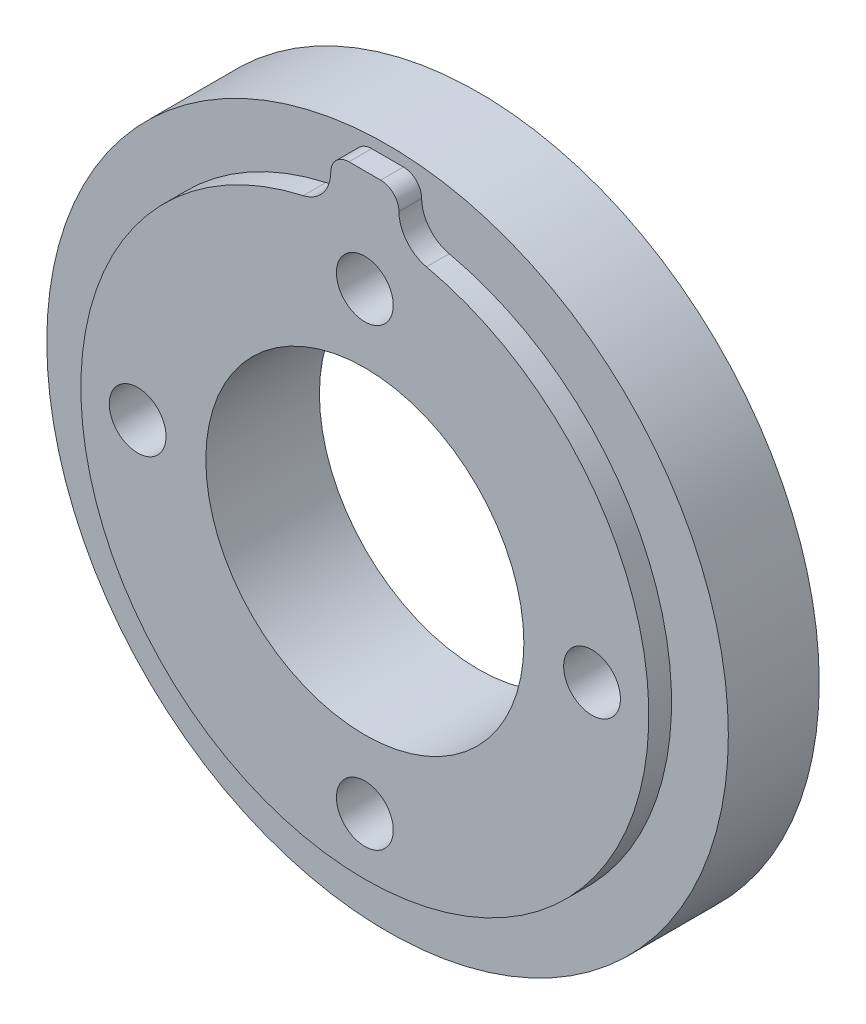
from build123d import *

# Parameters (mm, degrees)
SKETCH_1_R          = 15
EXTRUDE_1_DEPTH     = 4
EXTRUDE_2_DEPTH     = 1
FILLET_1_R          = 1.55
FILLET_2_R          = 0.8
SKETCH_3_R          = 7
CUT_EXTRUDE_1_DEPTH = 22.794494855
SKETCH_4_R          = 1.25
CUT_EXTRUDE_2_DEPTH = 22.794494878


with BuildPart() as part:
    # ｽｹｯﾁ1 → ﾎﾞｽ - 押し出し1 (new body)
    with BuildSketch(Plane.XY):
        Circle(SKETCH_1_R)
    extrude(amount=EXTRUDE_1_DEPTH)

    # ｽｹｯﾁ2 → ﾎﾞｽ - 押し出し2 (add)
    with BuildSketch(Plane.XY.offset(4)):
        with BuildLine():
            Line((1.5, 12.409673646), (1.5, 14.5))
            Line((1.5, 14.5), (-1.5, 14.5))
            Line((-1.5, 14.5), (-1.5, 12.409673646))
            ThreePointArc((-1.5, 12.409673646), (0, -12.5), (1.5, 12.409673646))
        make_face()
    extrude(amount=EXTRUDE_2_DEPTH)

    # ﾌｨﾚｯﾄ1
    fillet_1_edges = [part.edges().sort_by_distance(p)[0] for p in [
        (-1.5, 12.409673646, 4.5),
        (1.5, 12.409673646, 4.5),
    ]]
    fillet(fillet_1_edges, radius=FILLET_1_R)

    # ﾌｨﾚｯﾄ2
    fillet_2_edges = [part.edges().sort_by_distance(p)[0] for p in [
        (1.5, 14.5, 4.5),
        (-1.5, 14.5, 4.5),
    ]]
    fillet(fillet_2_edges, radius=FILLET_2_R)

    # ｽｹｯﾁ3 → ｶｯﾄ - 押し出し1 (cut, through all)
    with BuildSketch(Plane.XY.offset(5)):
        Circle(SKETCH_3_R)
    extrude(amount=-CUT_EXTRUDE_1_DEPTH, mode=Mode.SUBTRACT)

    # ｽｹｯﾁ4 → ｶｯﾄ - 押し出し2 (cut, through all)
    with BuildSketch(Plane(origin=(0, 0, 0), x_dir=(-1, 0, 0), z_dir=(0, 0, -1))):
        with Locations((0, 10)):
            Circle(SKETCH_4_R)
        with Locations((10, 0)):
            Circle(SKETCH_4_R)
        with Locations((0, -10)):
            Circle(SKETCH_4_R)
        with Locations((-10, 0)):
            Circle(SKETCH_4_R)
    extrude(amount=-CUT_EXTRUDE_2_DEPTH, mode=Mode.SUBTRACT)


solid = part.part
